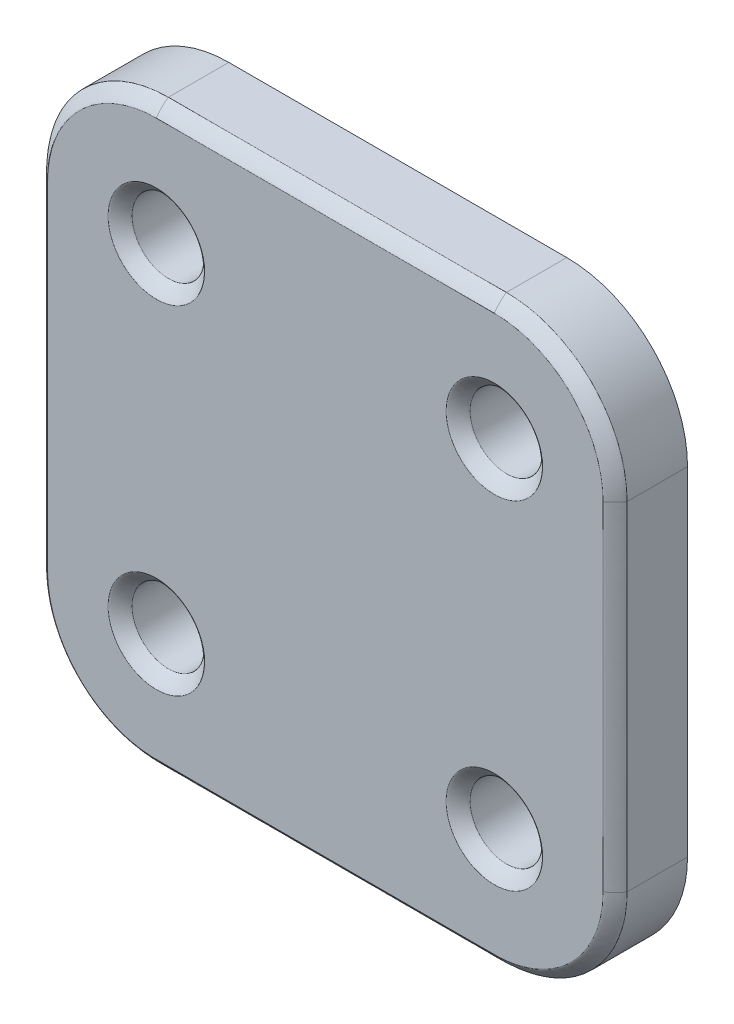
from build123d import *

# Parameters (mm, degrees)
ESQUISSE1_R             = 1.5
BOSS_EXTRU_1_DEPTH      = 3
ESQUISSE2_R             = 4.1
ENL_V_MAT_EXTRU_1_DEPTH = 1
CONG_1_SIZE             = 0.5


with BuildPart() as part:
    # Esquisse1 → Boss.-Extru.1 (new body)
    with BuildSketch(Plane.XY):
        with BuildLine():
            Line((7, -12), (-7, -12))
            ThreePointArc((-7, -12), (-10.535533906, -10.535533906), (-12, -7))
            Line((-12, -7), (-12, 7))
            ThreePointArc((-12, 7), (-10.535533906, 10.535533906), (-7, 12))
            Line((-7, 12), (7, 12))
            ThreePointArc((7, 12), (10.535533906, 10.535533906), (12, 7))
            Line((12, 7), (12, -7))
            ThreePointArc((12, -7), (10.535533906, -10.535533906), (7, -12))
        make_face()
        with Locations((-7, 7)):
            Circle(ESQUISSE1_R, mode=Mode.SUBTRACT)
        with Locations((7, 7)):
            Circle(ESQUISSE1_R, mode=Mode.SUBTRACT)
        with Locations((7, -7)):
            Circle(ESQUISSE1_R, mode=Mode.SUBTRACT)
        with Locations((-7, -7)):
            Circle(ESQUISSE1_R, mode=Mode.SUBTRACT)
    extrude(amount=BOSS_EXTRU_1_DEPTH)

    # Esquisse2 → Enlèv. mat.-Extru.1 (cut)
    with BuildSketch(Plane(origin=(0, 0, 0), x_dir=(-1, 0, 0), z_dir=(0, 0, -1))):
        Circle(ESQUISSE2_R)
    extrude(amount=-ENL_V_MAT_EXTRU_1_DEPTH, mode=Mode.SUBTRACT)

    # Congé1
    # a fillet whose section is not a circle: 0.5 mm, written as the material it takes off along each edge
    with BuildSketch(Plane(origin=(-7, -7, 3), x_dir=(1, 0, 0), z_dir=(0, -1, 0))) as cong_1_piece_1:
        with BuildLine():
            Bezier((1.5 + CONG_1_SIZE, 0), (1.5, 0), (1.5, -CONG_1_SIZE), weights=[1, 0.111111111, 1])
            Line((1.5, -CONG_1_SIZE), (1.5, 0))
            Line((1.5, 0), (1.5 + CONG_1_SIZE, 0))
        make_face()
    revolve(axis=Axis((-7, -7, 3), (0, 0, 1)), mode=Mode.SUBTRACT)
    with BuildSketch(Plane(origin=(7, -7, 3), x_dir=(1, 0, 0), z_dir=(0, -1, 0))) as cong_1_piece_2:
        with BuildLine():
            Bezier((1.5 + CONG_1_SIZE, 0), (1.5, 0), (1.5, -CONG_1_SIZE), weights=[1, 0.111111111, 1])
            Line((1.5, -CONG_1_SIZE), (1.5, 0))
            Line((1.5, 0), (1.5 + CONG_1_SIZE, 0))
        make_face()
    revolve(axis=Axis((7, -7, 3), (0, 0, 1)), mode=Mode.SUBTRACT)
    with BuildSketch(Plane(origin=(7, 7, 3), x_dir=(1, 0, 0), z_dir=(0, -1, 0))) as cong_1_piece_3:
        with BuildLine():
            Bezier((1.5 + CONG_1_SIZE, 0), (1.5, 0), (1.5, -CONG_1_SIZE), weights=[1, 0.111111111, 1])
            Line((1.5, -CONG_1_SIZE), (1.5, 0))
            Line((1.5, 0), (1.5 + CONG_1_SIZE, 0))
        make_face()
    revolve(axis=Axis((7, 7, 3), (0, 0, 1)), mode=Mode.SUBTRACT)
    with BuildSketch(Plane(origin=(-7, 7, 3), x_dir=(1, 0, 0), z_dir=(0, -1, 0))) as cong_1_piece_4:
        with BuildLine():
            Bezier((1.5 + CONG_1_SIZE, 0), (1.5, 0), (1.5, -CONG_1_SIZE), weights=[1, 0.111111111, 1])
            Line((1.5, -CONG_1_SIZE), (1.5, 0))
            Line((1.5, 0), (1.5 + CONG_1_SIZE, 0))
        make_face()
    revolve(axis=Axis((-7, 7, 3), (0, 0, 1)), mode=Mode.SUBTRACT)
    with BuildSketch(Plane(origin=(-12, -7, 3), x_dir=(1, 0, 0), z_dir=(0, 1, 0)), Plane(origin=(-7, 12, 3), x_dir=(0, -1, 0), z_dir=(1, 0, 0)), Plane(origin=(12, 7, 3), x_dir=(-1, 0, 0), z_dir=(0, -1, 0))) as cong_1_piece_5:
        with BuildLine():
            Bezier((CONG_1_SIZE, 0), (0, 0), (0, CONG_1_SIZE), weights=[1, 0.111111111, 1])
            Line((0, CONG_1_SIZE), (0, 0))
            Line((0, 0), (CONG_1_SIZE, 0))
        make_face()
    extrude(amount=14, mode=Mode.SUBTRACT)
    with BuildSketch(Plane(origin=(-7, 7, 3), x_dir=(-1, 0, 0), z_dir=(0, -1, 0))) as cong_1_piece_6:
        with BuildLine():
            Bezier((5 - CONG_1_SIZE, 0), (5, 0), (5, CONG_1_SIZE), weights=[1, 0.111111111, 1])
            Line((5, CONG_1_SIZE), (5, 0))
            Line((5, 0), (5 - CONG_1_SIZE, 0))
        make_face()
    revolve(axis=Axis((-7, 7, 3), (0, 0, -1)), revolution_arc=90, mode=Mode.SUBTRACT)
    with BuildSketch(Plane(origin=(7, 7, 3), x_dir=(0, 1, 0), z_dir=(-1, 0, 0))) as cong_1_piece_7:
        with BuildLine():
            Bezier((5 - CONG_1_SIZE, 0), (5, 0), (5, CONG_1_SIZE), weights=[1, 0.111111111, 1])
            Line((5, CONG_1_SIZE), (5, 0))
            Line((5, 0), (5 - CONG_1_SIZE, 0))
        make_face()
    revolve(axis=Axis((7, 7, 3), (0, 0, -1)), revolution_arc=90, mode=Mode.SUBTRACT)
    with BuildSketch(Plane(origin=(7, -7, 3), x_dir=(1, 0, 0), z_dir=(0, 1, 0))) as cong_1_piece_8:
        with BuildLine():
            Bezier((5, CONG_1_SIZE), (5, 0), (5 - CONG_1_SIZE, 0), weights=[1, 0.111111111, 1])
            Line((5 - CONG_1_SIZE, 0), (5, 0))
            Line((5, 0), (5, CONG_1_SIZE))
        make_face()
    revolve(axis=Axis((7, -7, 3), (0, 0, -1)), revolution_arc=90, mode=Mode.SUBTRACT)
    with BuildSketch(Plane(origin=(7, -12, 3), x_dir=(0, 0, -1), z_dir=(-1, 0, 0))) as cong_1_piece_9:
        with BuildLine():
            Bezier((CONG_1_SIZE, 0), (0, 0), (0, -CONG_1_SIZE), weights=[1, 0.111111111, 1])
            Line((0, -CONG_1_SIZE), (0, 0))
            Line((0, 0), (CONG_1_SIZE, 0))
        make_face()
    extrude(amount=14, mode=Mode.SUBTRACT)
    with BuildSketch(Plane(origin=(-7, -7, 3), x_dir=(0, -1, 0), z_dir=(1, 0, 0))) as cong_1_piece_10:
        with BuildLine():
            Bezier((5, CONG_1_SIZE), (5, 0), (5 - CONG_1_SIZE, 0), weights=[1, 0.111111111, 1])
            Line((5 - CONG_1_SIZE, 0), (5, 0))
            Line((5, 0), (5, CONG_1_SIZE))
        make_face()
    revolve(axis=Axis((-7, -7, 3), (0, 0, -1)), revolution_arc=90, mode=Mode.SUBTRACT)
    with BuildSketch(Plane(origin=(0, 0, 0), x_dir=(-1, 0, 0), z_dir=(0, -1, 0))) as cong_1_piece_11:
        with BuildLine():
            Bezier((4.1 + CONG_1_SIZE, 0), (4.1, 0), (4.1, -CONG_1_SIZE), weights=[1, 0.111111111, 1])
            Line((4.1, -CONG_1_SIZE), (4.1, 0))
            Line((4.1, 0), (4.1 + CONG_1_SIZE, 0))
        make_face()
    revolve(axis=Axis((0, 0, 0), (0, 0, -1)), mode=Mode.SUBTRACT)


solid = part.part
